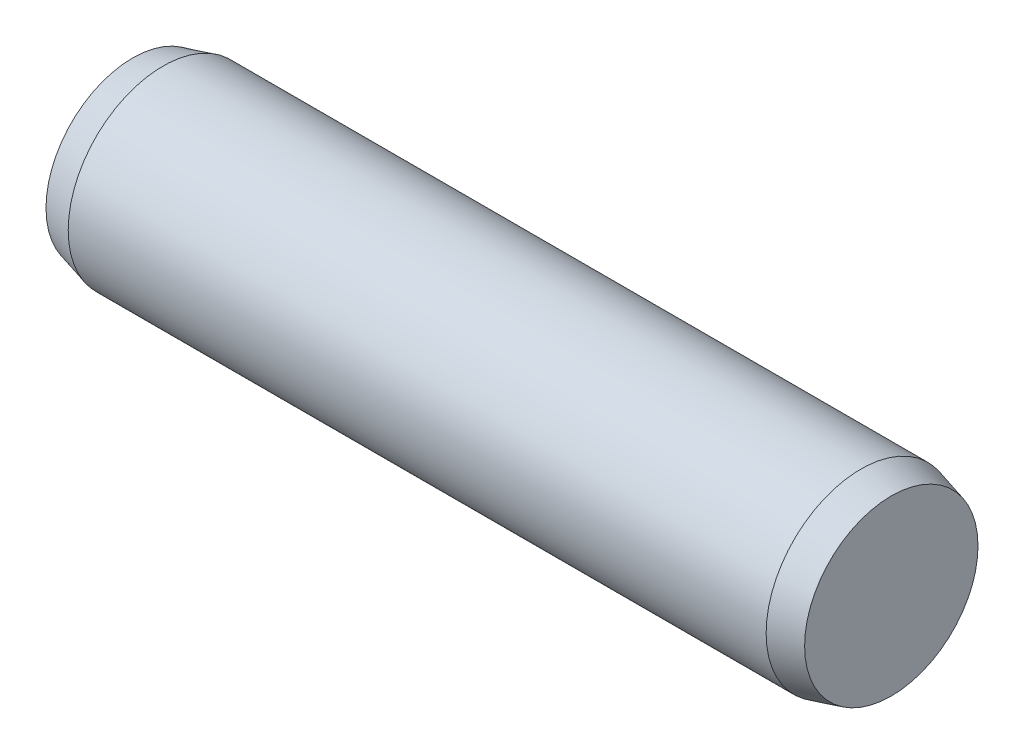
from build123d import *


with BuildPart() as part:
    # Sketch1 → Base-Revolve (revolve)
    with BuildSketch(Plane.XY):
        Polygon((0, 0), (100, 0), (100, 11.42820323), (96, 12.5), (4, 12.5), (0, 11.42820323), align=None)
    revolve(axis=Axis((-6.35, 0, 0), (1, 0, 0)))


solid = part.part
